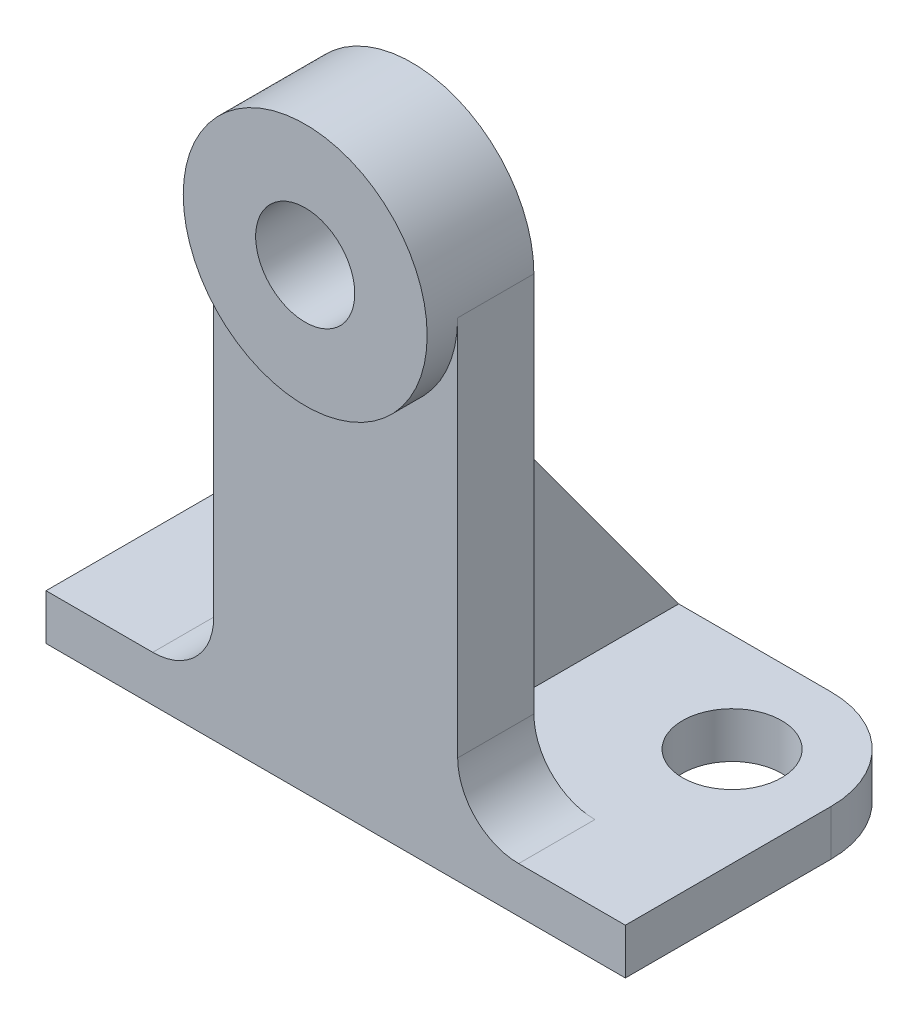
from build123d import *

# Parameters (mm, degrees)
SKETCH1_W               = 76
SKETCH1_H               = 40
BOSS_EXTRUDE1_DEPTH     = 6
BOSS_EXTRUDE2_START     = -10
BOSS_EXTRUDE2_OUTLINE_R = 6.5
BOSS_EXTRUDE2_DEPTH     = 10
SKETCH3_R               = 16
SKETCH3_R_2             = 6.5
BOSS_EXTRUDE3_DEPTH     = 4
SKETCH4_W               = 10
SKETCH4_H               = 41
BOSS_EXTRUDE4_DEPTH     = 30
CUT_EXTRUDE1_DEPTH      = 30
FILLET1_R               = 13
SKETCH6_R               = 6.5
CUT_EXTRUDE2_DEPTH      = 30


# Read off the part's stored shape, not the designer's step: Boss-Extrude2
with BuildPart() as part:
    # Sketch1 → Boss-Extrude1 (new body)
    with BuildSketch(Plane(origin=(0, 0, 0), x_dir=(1, 0, 0), z_dir=(0, 1, 0))):
        Rectangle(SKETCH1_W, SKETCH1_H)
    extrude(amount=-BOSS_EXTRUDE1_DEPTH)

    # Boss-Extrude2 outline → Boss-Extrude2 (add)
    with BuildSketch(Plane.XY.offset(20).offset(BOSS_EXTRUDE2_START)):
        with BuildLine():
            ThreePointArc((-16, 8), (-18.343145751, 2.343145751), (-24, 0))
            Line((-24, 0), (24, 0))
            ThreePointArc((24, 0), (18.343145751, 2.343145751), (16, 8))
            Line((16, 8), (16, 58))
            ThreePointArc((16, 58), (0, 74), (-16, 58))
            Line((-16, 58), (-16, 8))
        make_face()
        with Locations((0, 58)):
            Circle(BOSS_EXTRUDE2_OUTLINE_R, mode=Mode.SUBTRACT)
    extrude(amount=BOSS_EXTRUDE2_DEPTH)

    # Sketch3 → Boss-Extrude3 (add)
    with BuildSketch(Plane.XY.offset(20)):
        with Locations((0, 58)):
            Circle(SKETCH3_R)
        with Locations((0, 58)):
            Circle(SKETCH3_R_2, mode=Mode.SUBTRACT)
    extrude(amount=BOSS_EXTRUDE3_DEPTH)

    # Sketch4 → Boss-Extrude4 (add)
    with BuildSketch(Plane(origin=(0, 0, 10), x_dir=(-1, 0, 0), z_dir=(0, 0, -1))):
        with Locations((0, 20.5)):
            Rectangle(SKETCH4_W, SKETCH4_H)
    extrude(amount=BOSS_EXTRUDE4_DEPTH)

    # Sketch5 → Cut-Extrude1 (cut)
    with BuildSketch(Plane.ZY.offset(5)):
        Polygon((-20, 0), (10, 41), (-20, 41), align=None)
    extrude(amount=-CUT_EXTRUDE1_DEPTH, mode=Mode.SUBTRACT)

    # Fillet1
    fillet1_edges = [part.edges().sort_by_distance(p)[0] for p in [
        (-38, -3, -20),
        (38, -3, -20),
    ]]
    fillet(fillet1_edges, radius=FILLET1_R)

    # Sketch6 → Cut-Extrude2 (cut)
    with BuildSketch(Plane(origin=(0, 0, 0), x_dir=(1, 0, 0), z_dir=(0, 1, 0))):
        with Locations(Location((25, 7, 0), (0, 0, 270))):
            Circle(SKETCH6_R)
        with Locations(Location((-25, 7, 0), (0, 0, 270))):
            Circle(SKETCH6_R)
    extrude(amount=-CUT_EXTRUDE2_DEPTH, mode=Mode.SUBTRACT)


solid = part.part
